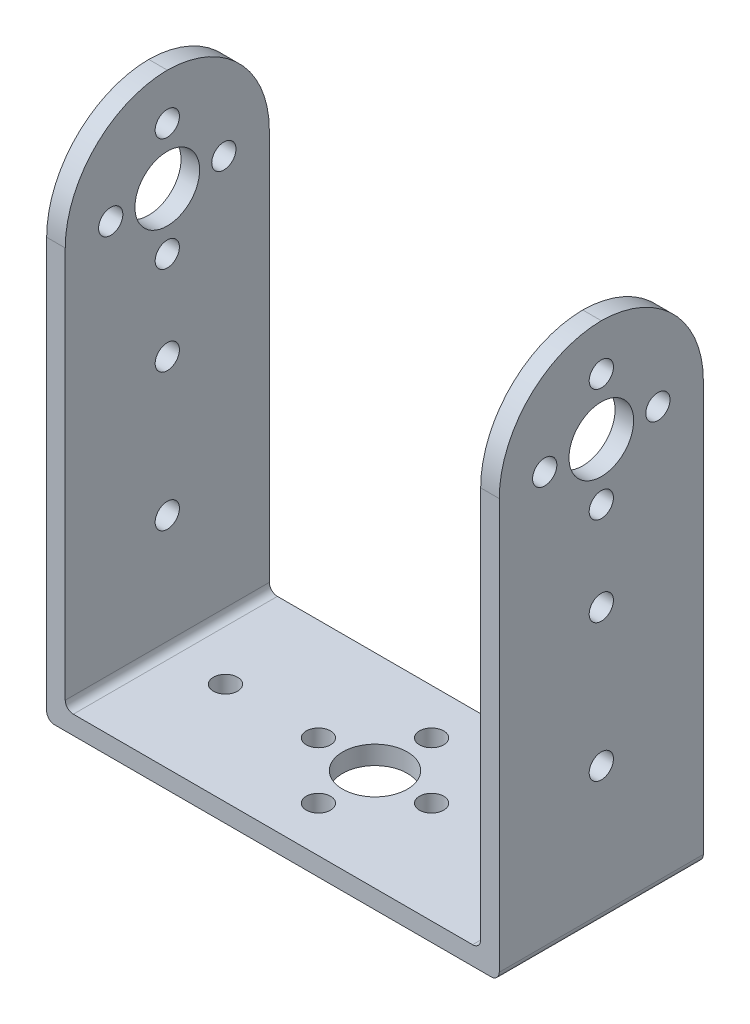
from build123d import *

# Parameters (mm, degrees)
SKETCH1_W           = 56
SKETCH1_H           = 64.5
BOSS_EXTRUDE1_DEPTH = 25.25
SKETCH2_W           = 51.4
SKETCH2_H           = 62.2
CUT_EXTRUDE1_DEPTH  = 50.614765947
FILLET1_R           = 1
FILLET3_R           = 12.75
SKETCH4_R           = 4
SKETCH4_R_2         = 1.5
CUT_EXTRUDE3_DEPTH  = 75.710999554
SKETCH5_R           = 4
SKETCH5_R_2         = 1.5
CUT_EXTRUDE4_DEPTH  = 70.380292591


with BuildPart() as part:
    # Sketch1 → Boss-Extrude1 (new body)
    with BuildSketch(Plane.XY):
        Rectangle(SKETCH1_W, SKETCH1_H)
    extrude(amount=BOSS_EXTRUDE1_DEPTH)

    # Sketch2 → Cut-Extrude1 (cut, through all)
    with BuildSketch(Plane.XY.offset(25.25)):
        with Locations((0, 1.15)):
            Rectangle(SKETCH2_W, SKETCH2_H)
    extrude(amount=-CUT_EXTRUDE1_DEPTH, mode=Mode.SUBTRACT)

    # Fillet1
    fillet1_edges = [part.edges().sort_by_distance(p)[0] for p in [
        (-25.7, -29.95, 12.625),
        (25.7, -29.95, 12.625),
        (28, -32.25, 12.625),
        (-28, -32.25, 12.625),
    ]]
    fillet(fillet1_edges, radius=FILLET1_R)

    # Fillet3
    # the kernel refuses this fillet: 12.75 mm, written as the material it takes off along each edge
    with BuildSketch(Plane(origin=(-59.875, 32.25, 25.25), x_dir=(0, 0, -1), z_dir=(1, 0, 0)), Plane(origin=(-6.175, 32.25, 25.25), x_dir=(0, 0, -1), z_dir=(1, 0, 0)), Plane(origin=(-59.875, 32.25, 0), x_dir=(0, -1, 0), z_dir=(1, 0, 0)), Plane(origin=(-6.175, 32.25, 0), x_dir=(0, -1, 0), z_dir=(1, 0, 0))) as fillet3_piece_1:
        with BuildLine():
            CenterArc((FILLET3_R, -FILLET3_R), FILLET3_R, 90, 90)
            Line((0, -FILLET3_R), (0, 0))
            Line((0, 0), (FILLET3_R, 0))
        make_face()
    extrude(amount=66.05, mode=Mode.SUBTRACT)

    # Sketch4 → Cut-Extrude3 (cut, through all)
    with BuildSketch(Plane.XZ.offset(32.25)):
        with Locations(Location((0, 12.625, 0), (0, 0, 270))):
            Circle(SKETCH4_R)
        with Locations(Location((7, 12.625, 0), (0, 0, 270))):
            Circle(SKETCH4_R_2)
        with Locations(Location((-7, 12.625, 0), (0, 0, 270))):
            Circle(SKETCH4_R_2)
        with Locations(Location((0, 5.625, 0), (0, 0, 270))):
            Circle(SKETCH4_R_2)
        with Locations(Location((0, 19.625, 0), (0, 0, 270))):
            Circle(SKETCH4_R_2)
        with Locations(Location((18.5, 12.625, 0), (0, 0, 270))):
            Circle(SKETCH4_R_2)
        with Locations(Location((-18.5, 12.625, 0), (0, 0, 270))):
            Circle(SKETCH4_R_2)
    extrude(amount=-CUT_EXTRUDE3_DEPTH, mode=Mode.SUBTRACT)

    # Sketch5 → Cut-Extrude4 (cut, through all)
    with BuildSketch(Plane.ZY.offset(28)):
        with Locations(Location((12.625, 19.54938724, 0), (0, 0, 270))):
            Circle(SKETCH5_R)
        with Locations(Location((12.625, 26.54938724, 0), (0, 0, 270))):
            Circle(SKETCH5_R_2)
        with Locations(Location((19.625, 19.54938724, 0), (0, 0, 270))):
            Circle(SKETCH5_R_2)
        with Locations(Location((12.625, 12.54938724, 0), (0, 0, 270))):
            Circle(SKETCH5_R_2)
        with Locations(Location((5.625, 19.54938724, 0), (0, 0, 270))):
            Circle(SKETCH5_R_2)
        with Locations(Location((12.625, 1.54938724, 0), (0, 0, 270))):
            Circle(SKETCH5_R_2)
        with Locations(Location((12.625, -15.45061276, 0), (0, 0, 270))):
            Circle(SKETCH5_R_2)
    extrude(amount=-CUT_EXTRUDE4_DEPTH, mode=Mode.SUBTRACT)


solid = part.part
